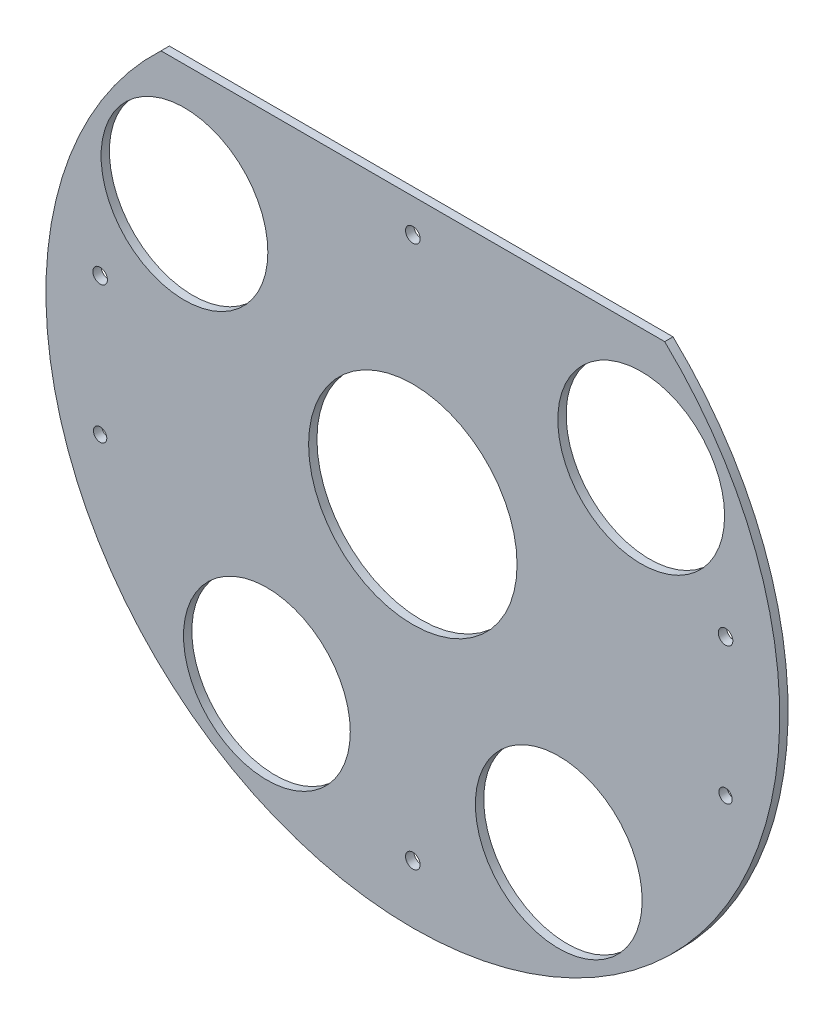
from build123d import *

# Parameters (mm, degrees)
SKETCH1_R           = 25
SKETCH1_R_2         = 20
SKETCH1_R_3         = 1.75
SKETCH1_R_4         = 1.6
EXTRUDE1_DEPTH      = 0.5
SKETCH2_R           = 1.6
SKETCH2_R_2         = 1.75
SKETCH2_R_3         = 20
SKETCH2_R_4         = 25
BOSS_EXTRUDE1_DEPTH = 1.5


with BuildPart() as part:
    # Sketch1 → Extrude1 (new body)
    with BuildSketch(Plane.XY):
        with BuildLine():
            Line((-60.398675482, 64), (60.398675482, 64))
            ThreePointArc((60.398675482, 64), (0, -88), (-60.398675482, 64))
        make_face()
        Circle(SKETCH1_R, mode=Mode.SUBTRACT)
        with Locations((-35, -54.772255751)):
            Circle(SKETCH1_R_2, mode=Mode.SUBTRACT)
        with Locations((-54.772255751, 35)):
            Circle(SKETCH1_R_2, mode=Mode.SUBTRACT)
        with Locations((54.772255751, 35)):
            Circle(SKETCH1_R_2, mode=Mode.SUBTRACT)
        with Locations((35, -54.772255751)):
            Circle(SKETCH1_R_2, mode=Mode.SUBTRACT)
        with Locations((-75, 10)):
            Circle(SKETCH1_R_3, mode=Mode.SUBTRACT)
        with Locations((0, 56)):
            Circle(SKETCH1_R_3, mode=Mode.SUBTRACT)
        with Locations((0, -74)):
            Circle(SKETCH1_R_3, mode=Mode.SUBTRACT)
        with Locations((75, 10)):
            Circle(SKETCH1_R_3, mode=Mode.SUBTRACT)
        with Locations((-75, -23)):
            Circle(SKETCH1_R_4, mode=Mode.SUBTRACT)
        with Locations((75, -23)):
            Circle(SKETCH1_R_4, mode=Mode.SUBTRACT)
    extrude(amount=EXTRUDE1_DEPTH)

    # Sketch2 → Boss-Extrude1 (add)
    with BuildSketch(Plane.XY.offset(0.5)):
        with BuildLine():
            Line((60.398675482, 64), (-60.398675482, 64))
            ThreePointArc((-60.398675482, 64), (0, -88), (60.398675482, 64))
        make_face()
        with Locations((75, -23)):
            Circle(SKETCH2_R, mode=Mode.SUBTRACT)
        with Locations((-75, -23)):
            Circle(SKETCH2_R, mode=Mode.SUBTRACT)
        with Locations((75, 10)):
            Circle(SKETCH2_R_2, mode=Mode.SUBTRACT)
        with Locations((0, -74)):
            Circle(SKETCH2_R_2, mode=Mode.SUBTRACT)
        with Locations((-75, 10)):
            Circle(SKETCH2_R_2, mode=Mode.SUBTRACT)
        with Locations((54.772255751, 35)):
            Circle(SKETCH2_R_3, mode=Mode.SUBTRACT)
        with Locations((-35, -54.772255751)):
            Circle(SKETCH2_R_3, mode=Mode.SUBTRACT)
        Circle(SKETCH2_R_4, mode=Mode.SUBTRACT)
        with Locations((-54.772255751, 35)):
            Circle(SKETCH2_R_3, mode=Mode.SUBTRACT)
        with Locations((35, -54.772255751)):
            Circle(SKETCH2_R_3, mode=Mode.SUBTRACT)
        with Locations((0, 56)):
            Circle(SKETCH2_R_2, mode=Mode.SUBTRACT)
    extrude(amount=BOSS_EXTRUDE1_DEPTH)


solid = part.part
